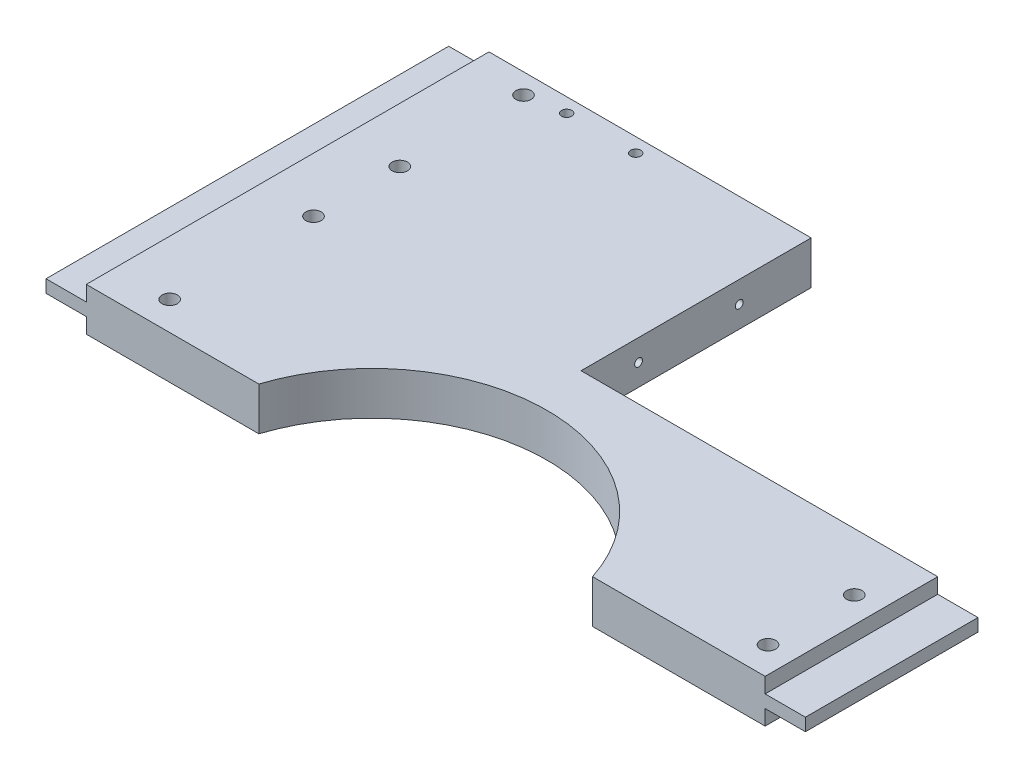
from build123d import *

# Parameters (mm, degrees)
BOSS_EXTRUDE1_DEPTH       = 9.525
SKETCH2_W                 = 17.78
SKETCH2_H                 = 177.8
SKETCH2_H_2               = 76.2
BOSS_EXTRUDE2_DEPTH       = 2.794
F_1_4_CLEARANCE_HOLE1_D   = 6.7564
F_8_CLEARANCE_HOLE1_D     = 4.4958
F_1_4_CLEARANCE_HOLE2_D   = 6.7564
F_8_32_TAPPED_HOLE1_D     = 3.4544
F_8_32_TAPPED_HOLE1_DEPTH = 10.668
F_8_32_TAPPED_HOLE1_TIP   = 1.037806461
F_8_32_TAPPED_HOLE2_D     = 3.4544
F_8_32_TAPPED_HOLE2_DEPTH = 10.668
F_8_32_TAPPED_HOLE2_TIP   = 1.037806461


with BuildPart() as part:
    # Sketch1 → Boss-Extrude1 (new, symmetric)
    with BuildSketch(Plane(origin=(0, 0, 0), x_dir=(1, 0, 0), z_dir=(0, 1, 0))):
        with BuildLine():
            Line((0, 101.6), (-142.24, 101.6))
            Line((-142.24, 101.6), (-142.24, -76.2))
            Line((-142.24, -76.2), (-66.04, -76.2))
            ThreePointArc((-66.04, -76.2), (7.62, -22.633025988), (81.28, -76.2))
            Line((81.28, -76.2), (157.48, -76.2))
            Line((157.48, -76.2), (157.48, 0))
            Line((157.48, 0), (0, 0))
            Line((0, 0), (0, 101.6))
        make_face()
    extrude(amount=BOSS_EXTRUDE1_DEPTH, both=True)

    # Sketch2 → Boss-Extrude2 (add, symmetric)
    with BuildSketch(Plane(origin=(0, 0, 0), x_dir=(1, 0, 0), z_dir=(0, 1, 0))):
        with Locations((-151.13, 12.7)):
            Rectangle(SKETCH2_W, SKETCH2_H)
        with Locations((166.37, -38.1)):
            Rectangle(SKETCH2_W, SKETCH2_H_2)
    extrude(amount=BOSS_EXTRUDE2_DEPTH, both=True)

    # 1/4 Clearance Hole1 (through all)
    with Locations(Plane(origin=(0, 9.525, 0), x_dir=(1, 0, 0), z_dir=(0, 1, 0))):
        with Locations((-118.11, 92.71), (-118.11, 38.1), (-118.11, 0), (-118.11, -63.5)):
            Hole(F_1_4_CLEARANCE_HOLE1_D / 2)

    # #8 Clearance Hole1 (through all)
    with Locations(Plane(origin=(0, 9.525, 0), x_dir=(1, 0, 0), z_dir=(0, 1, 0))):
        with Locations((-101.6, 95.25), (-71.12, 95.25)):
            Hole(F_8_CLEARANCE_HOLE1_D / 2)

    # 1/4 Clearance Hole2 (through all)
    with Locations(Plane(origin=(0, 9.525, 0), x_dir=(1, 0, 0), z_dir=(0, 1, 0))):
        with Locations((146.05, -25.4), (146.05, -63.5)):
            Hole(F_1_4_CLEARANCE_HOLE2_D / 2)

    # #8-32 Tapped Hole1
    with Locations(Plane(origin=(0, 0, 0), x_dir=(-1, 0, 0), z_dir=(0, 0, -1))):
        with Locations((-137.16, 0), (-106.68, 0), (-55.88, 0), (-15.24, 0)):
            Hole(F_8_32_TAPPED_HOLE1_D / 2, depth=F_8_32_TAPPED_HOLE1_DEPTH)
            with Locations((0, 0, -(F_8_32_TAPPED_HOLE1_DEPTH + F_8_32_TAPPED_HOLE1_TIP / 2))):  # 118° drill point
                Cone(0, F_8_32_TAPPED_HOLE1_D / 2, F_8_32_TAPPED_HOLE1_TIP, mode=Mode.SUBTRACT)

    # #8-32 Tapped Hole2
    with Locations(Plane(origin=(0, 0, 0), x_dir=(0, 0, -1), z_dir=(1, 0, 0))):
        with Locations((69.85, 0), (25.4, 0)):
            Hole(F_8_32_TAPPED_HOLE2_D / 2, depth=F_8_32_TAPPED_HOLE2_DEPTH)
            with Locations((0, 0, -(F_8_32_TAPPED_HOLE2_DEPTH + F_8_32_TAPPED_HOLE2_TIP / 2))):  # 118° drill point
                Cone(0, F_8_32_TAPPED_HOLE2_D / 2, F_8_32_TAPPED_HOLE2_TIP, mode=Mode.SUBTRACT)


solid = part.part
